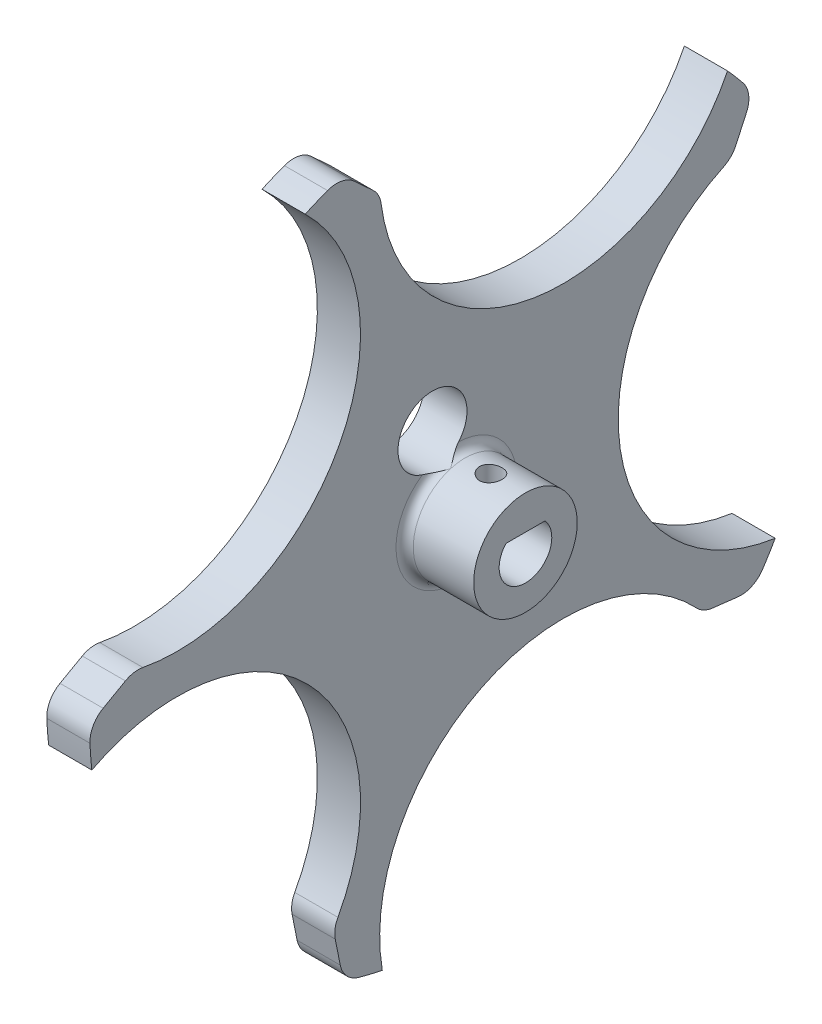
from build123d import *

# Parameters (mm, degrees)
EXTRUDE_2_DEPTH     = 2.5
SKETCH_4_R          = 6
EXTRUDE_3_DEPTH     = 8
CUT_EXTRUDE_5_DEPTH = 11.5
SKETCH_14_R         = 1.6
CUT_EXTRUDE_6_DEPTH = 12
SKETCH_15_R         = 1.3
CUT_EXTRUDE_7_DEPTH = 11
FILLET_7_R          = 1
FILLET1_R           = 3
SKETCH1_R           = 4
CUT_EXTRUDE2_DEPTH  = 50


with BuildPart() as part:
    # 草图2 → 凸台-拉伸2 (new, symmetric)
    with BuildSketch(Plane.ZY.offset(38.091621509)):
        with BuildLine():
            Line((55.24762265, 27.512579341), (50.911357014, 23.516558631))
            ThreePointArc((50.911357014, 23.516558631), (33.760797652, 4.281653093), (10.672961639, 15.730456776))
            ThreePointArc((10.672961639, 15.730456776), (9.146547949, 13.960204765), (7.719768364, 12.108710517))
            Line((7.719768364, 12.108710517), (10.180230126, 6.749838518))
            ThreePointArc((10.180230126, 6.749838518), (23.173898072, -15.505225418), (5.150905034, -33.925187402))
            ThreePointArc((5.150905034, -33.925187402), (6.362826974, -35.923931044), (7.682803504, -37.853022253))
            Line((7.682803504, -37.853022253), (13.539718137, -37.16896658))
            ThreePointArc((13.539718137, -37.16896658), (38.720805929, -31.688446976), (50.669819665, -54.521413236))
            ThreePointArc((50.669819665, -54.521413236), (52.945242306, -53.986452731), (55.187812251, -53.327202418))
            Line((55.187812251, -53.327202418), (56.347122801, -47.545560763))
            ThreePointArc((56.347122801, -47.545560763), (58.916222984, -21.903349436), (84.324112643, -17.594936665))
            ThreePointArc((84.324112643, -17.594936665), (84.518479234, -15.265569248), (84.584487152, -12.929038938))
            Line((84.584487152, -12.929038938), (79.444065843, -10.039843558))
            ThreePointArc((79.444065843, -10.039843558), (55.850769285, 0.327394986), (59.60469494, 25.823106776))
            ThreePointArc((59.60469494, 25.823106776), (57.449397458, 26.727774506), (55.24762265, 27.512579341))
        make_face()
    extrude(amount=EXTRUDE_2_DEPTH, both=True)

    # 草图4 → 凸台-拉伸3 (add)
    with BuildSketch(Plane(origin=(-35.591621509, 0, 0), x_dir=(0, 0, -1), z_dir=(1, 0, 0))):
        with Locations((-42.084498784, -12.89759475)):
            Circle(SKETCH_4_R)
    extrude(amount=EXTRUDE_3_DEPTH)

    # 草图13 → 切除-拉伸5 (cut)
    with BuildSketch(Plane(origin=(-27.591621509, 0, 0), x_dir=(0, 0, -1), z_dir=(1, 0, 0))):
        with BuildLine():
            Line((-44.342816742, -10.84759475), (-39.826180826, -10.84759475))
            ThreePointArc((-39.826180826, -10.84759475), (-42.084498784, -15.94759475), (-44.342816742, -10.84759475))
        make_face()
    extrude(amount=-CUT_EXTRUDE_5_DEPTH, mode=Mode.SUBTRACT)

    # 草图14 → 切除-拉伸6 (cut)
    with BuildSketch(Plane.ZY.offset(40.591621509)):
        with Locations((42.084498784, -12.89759475)):
            Circle(SKETCH_14_R)
    extrude(amount=-CUT_EXTRUDE_6_DEPTH, mode=Mode.SUBTRACT)

    # 草图15 → 切除-拉伸7 (cut)
    with BuildSketch(Plane.XZ.offset(10.84759475)):
        with Locations((-31.591621509, 42.084498784)):
            Circle(SKETCH_15_R)
    extrude(amount=-CUT_EXTRUDE_7_DEPTH, mode=Mode.SUBTRACT)

    # 圆角7
    fillet_7_edges = [part.edges().sort_by_distance(p)[0] for p in [
        (-35.591621509, -12.89759475, 48.084498784),
    ]]
    fillet(fillet_7_edges, radius=FILLET_7_R)

    # Fillet1
    fillet1_edges = [part.edges().sort_by_distance(p)[0] for p in [
        (-38.091621509, -47.545560763, 56.347122801),
        (-38.091621509, -53.327202418, 55.187812251),
        (-38.091621509, -37.853022253, 7.682803504),
        (-38.091621509, -37.16896658, 13.539718137),
        (-38.091621509, 6.749838518, 10.180230126),
        (-38.091621509, 12.108710517, 7.719768364),
        (-38.091621509, -12.929038938, 84.584487152),
        (-38.091621509, -10.039843558, 79.444065843),
        (-38.091621509, 27.512579341, 55.24762265),
        (-38.091621509, 23.516558631, 50.911357014),
    ]]
    fillet(fillet1_edges, radius=FILLET1_R)

    # Sketch1 → Cut-Extrude2 (cut)
    with BuildSketch(Plane.ZY.offset(40.591621509)):
        with Locations((44.856906438, -3.289589973)):
            Circle(SKETCH1_R)
    extrude(amount=-CUT_EXTRUDE2_DEPTH, mode=Mode.SUBTRACT)


solid = part.part
